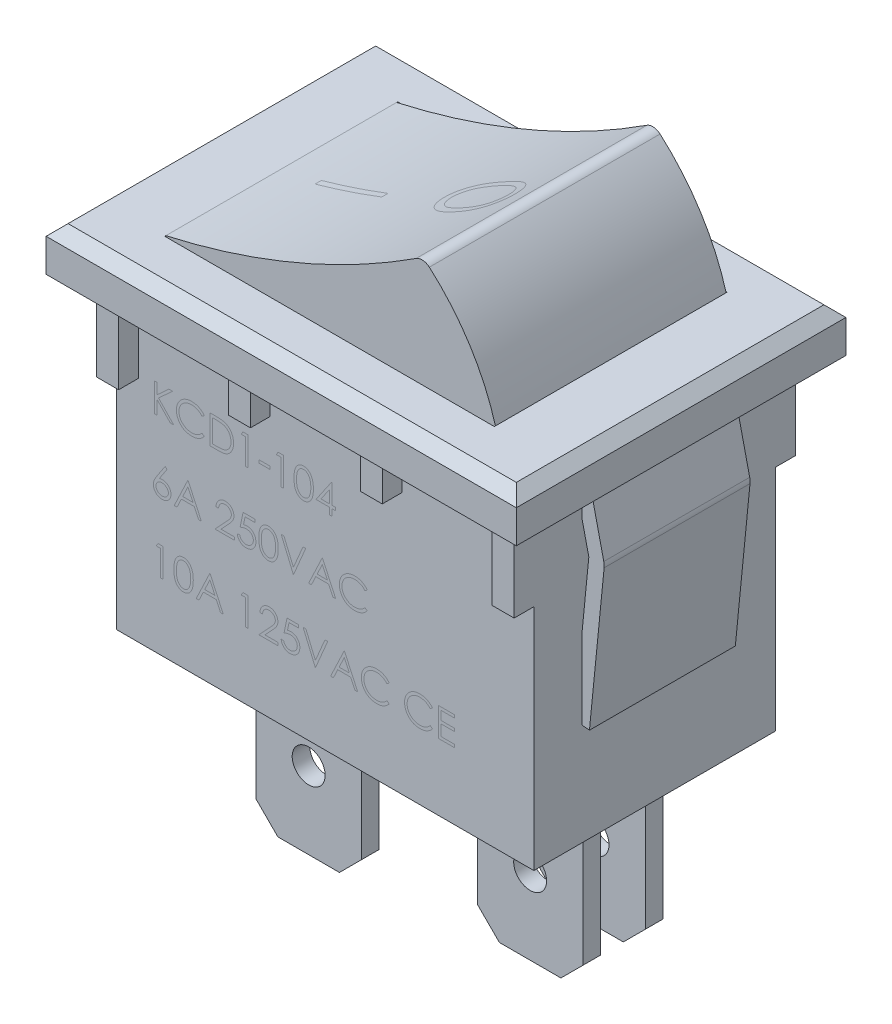
from build123d import *
from build123d.topology import SkipClean

# Parameters (mm, degrees)
SKETCH1_W              = 19
SKETCH1_H              = 14.4
BOSS_EXTRUDE1_DEPTH    = 5.5
SKETCH2_W              = 21.4
SKETCH2_H              = 15
BOSS_EXTRUDE2_DEPTH    = 2
CHAMFER1_SIZE          = 0.5
SKETCH11_W             = 15
SKETCH11_H             = 10.6
CUT_EXTRUDE6_DEPTH     = 0.25
BOSS_EXTRUDE3_DEPTH    = 5.25
SKETCH5_W              = 4.8
SKETCH5_H              = 0.8
BOSS_EXTRUDE5_DEPTH    = 7.3
CHAMFER2_SIZE          = 1
EXTRUDE_THIN14_DEPTH   = 3.32
EXTRUDE_THIN14_2_DEPTH = 3.32
SKETCH10_W             = 19
SKETCH10_H             = 14.4
CUT_EXTRUDE5_DEPTH     = 22.019333957
SKETCH12_R             = 0.75
CUT_EXTRUDE7_DEPTH     = 10
SKETCH13_W             = 1
SKETCH13_H             = 0.9
BOSS_EXTRUDE6_DEPTH    = 4
SKETCH14_W             = 1
SKETCH14_H             = 0.9
BOSS_EXTRUDE7_DEPTH    = 2.5
SKETCH15_R             = 0.5
CUT_EXTRUDE9_DEPTH     = 1.5
SKETCH17_R             = 0.75
CUT_EXTRUDE10_DEPTH    = 0.5
CUT_EXTRUDE11_DEPTH    = 0.4
CUT_EXTRUDE12_DEPTH    = 0.4


with BuildPart() as part:
    # Sketch1 → Boss-Extrude1 (new, symmetric)
    with BuildSketch(Plane.XY):
        Rectangle(SKETCH1_W, SKETCH1_H)
    extrude(amount=BOSS_EXTRUDE1_DEPTH, both=True)

    # Sketch2 → Boss-Extrude2 (add)
    with BuildSketch(Plane(origin=(0, 7.2, 0), x_dir=(1, 0, 0), z_dir=(0, 1, 0))):
        Rectangle(SKETCH2_W, SKETCH2_H)
    extrude(amount=BOSS_EXTRUDE2_DEPTH)

    # Chamfer1
    chamfer1_edges = [part.edges().sort_by_distance(p)[0] for p in [
        (0, 9.2, -7.5),
        (10.7, 9.2, 0),
        (0, 9.2, 7.5),
        (-10.7, 9.2, 0),
    ]]
    chamfer(chamfer1_edges, length=CHAMFER1_SIZE)

    # Sketch11 → Cut-Extrude6 (cut)
    with BuildSketch(Plane(origin=(0, 9.2, 0), x_dir=(1, 0, 0), z_dir=(0, 1, 0))):
        Rectangle(SKETCH11_W, SKETCH11_H)
    extrude(amount=-CUT_EXTRUDE6_DEPTH, mode=Mode.SUBTRACT)

    # Sketch3 → Boss-Extrude3 (add, symmetric)
    with BuildSketch(Plane.XY):
        with BuildLine():
            Line((-7.5, 9.2), (-7.5, 8.9))
            Line((-7.5, 8.9), (7.5, 8.9))
            Line((7.5, 8.9), (7.5, 9.2))
            ThreePointArc((7.5, 9.2), (6.337266906, 11.791954262), (4.492593026, 13.95236011))
            ThreePointArc((4.492593026, 13.95236011), (4.198663798, 14.075644793), (3.88996536, 13.996279949))
            ThreePointArc((3.88996536, 13.996279949), (-1.591643465, 11.091430432), (-7.5, 9.2))
        make_face()
    extrude(amount=BOSS_EXTRUDE3_DEPTH, both=True)

    # Sketch5 → Boss-Extrude5 (add)
    with BuildSketch(Plane.XZ.offset(7.2)):
        with Locations((5.65, 1.42)):
            Rectangle(SKETCH5_W, SKETCH5_H)
        with Locations((-3.55, -2.3)):
            Rectangle(SKETCH5_W, SKETCH5_H)
        with Locations((5.65, -1.42)):
            Rectangle(SKETCH5_W, SKETCH5_H)
        with Locations((-3.55, 2.3)):
            Rectangle(SKETCH5_W, SKETCH5_H)
    extrude(amount=BOSS_EXTRUDE5_DEPTH)

    # Chamfer2
    chamfer2_edges = [part.edges().sort_by_distance(p)[0] for p in [
        (8.05, -14.5, 1.42),
        (3.25, -14.5, 1.42),
        (-1.15, -14.5, -2.3),
        (-5.95, -14.5, -2.3),
        (8.05, -14.5, -1.42),
        (3.25, -14.5, -1.42),
        (-1.15, -14.5, 2.3),
        (-5.95, -14.5, 2.3),
    ]]
    chamfer(chamfer2_edges, length=CHAMFER2_SIZE)

    # Sketch12 → Cut-Extrude7 (cut)
    with BuildSketch(Plane.XY.offset(2.7)):
        with Locations((-3.55, -11)):
            Circle(SKETCH12_R)
        with Locations((5.65, -11)):
            Circle(SKETCH12_R)
    extrude(amount=-CUT_EXTRUDE7_DEPTH, mode=Mode.SUBTRACT)

    # Sketch13 → Boss-Extrude6 (add)
    with BuildSketch(Plane.XZ.offset(-7.2)):
        with Locations((-9, 5.95)):
            Rectangle(SKETCH13_W, SKETCH13_H)
        with Locations((9, 5.95)):
            Rectangle(SKETCH13_W, SKETCH13_H)
        with Locations((9, -5.95)):
            Rectangle(SKETCH13_W, SKETCH13_H)
        with Locations((-9, -5.95)):
            Rectangle(SKETCH13_W, SKETCH13_H)
    extrude(amount=BOSS_EXTRUDE6_DEPTH)

    # Sketch14 → Boss-Extrude7 (add)
    with BuildSketch(Plane.XZ.offset(-7.2)):
        with Locations((-3, 5.95)):
            Rectangle(SKETCH14_W, SKETCH14_H)
        with Locations((3, 5.95)):
            Rectangle(SKETCH14_W, SKETCH14_H)
        with Locations((3, -5.95)):
            Rectangle(SKETCH14_W, SKETCH14_H)
        with Locations((-3, -5.95)):
            Rectangle(SKETCH14_W, SKETCH14_H)
    extrude(amount=BOSS_EXTRUDE7_DEPTH)

    # Sketch15 → Cut-Extrude9 (cut)
    with BuildSketch(Plane.XY.offset(5.5)):
        with Locations((0, 6.2)):
            Circle(SKETCH15_R)
    extrude(amount=-CUT_EXTRUDE9_DEPTH, mode=Mode.SUBTRACT)

    # Sketch17 → Cut-Extrude10 (cut)
    with BuildSketch(Plane.XY.offset(5.5)):
        with Locations((0, 6.2)):
            Circle(SKETCH17_R)
    extrude(amount=-CUT_EXTRUDE10_DEPTH, mode=Mode.SUBTRACT)

    # Sketch18 → Revolve1 (revolve)
    with BuildSketch(Plane(origin=(0, 0, 0), x_dir=(0, 0, -1), z_dir=(1, 0, 0))):
        with BuildLine():
            Line((-5.5, 6.2), (-5, 6.2))
            Line((-5, 6.2), (-5, 6.95))
            ThreePointArc((-5, 6.95), (-5.354552722, 6.644701815), (-5.5, 6.2))
        make_face()
    revolve(axis=Axis((0, 6.2, 4), (0, 0, 1)))

    # Sketch19 → Cut-Extrude11 (cut)
    with BuildSketch(Plane.XY.offset(5.5)):
        with BuildLine():
            Line((-0.05, 6.948331477), (-0.05, 5.451668523))
            ThreePointArc((-0.05, 5.451668523), (0, 5.45), (0.05, 5.451668523))
            Line((0.05, 5.451668523), (0.05, 6.948331477))
            ThreePointArc((0.05, 6.948331477), (0, 6.95), (-0.05, 6.948331477))
        make_face()
    extrude(amount=-CUT_EXTRUDE11_DEPTH, mode=Mode.SUBTRACT)

    # Sketch20 → Cut-Extrude12 (cut)
    with SkipClean():  # the faces are left unmerged after this step: merging them gives an invalid solid
        with BuildSketch(Plane.XY.offset(5.5)):
            with BuildLine():
                Line((-0.748331477, 6.25), (0.748331477, 6.25))
                ThreePointArc((0.748331477, 6.25), (0.75, 6.2), (0.748331477, 6.15))
                Line((0.748331477, 6.15), (-0.748331477, 6.15))
                ThreePointArc((-0.748331477, 6.15), (-0.75, 6.2), (-0.748331477, 6.25))
            make_face()
        extrude(amount=-CUT_EXTRUDE12_DEPTH, mode=Mode.SUBTRACT)


with BuildPart() as body_2:
    # Sketch9 → Extrude-Thin14 (new, symmetric)
    with BuildSketch(Plane.XY):
        with BuildLine():
            Line((-9.841182523, 7.278067188), (-10.501606571, 4.391769498))
            ThreePointArc((-10.501606571, 4.391769498), (-10.519013265, 4.271701672), (-10.516833193, 4.150398238))
            Line((-10.516833193, 4.150398238), (-9.84828828, -2.584572734))
            Line((-9.84828828, -2.584572734), (-9.15171172, -2.515427266))
            Line((-9.15171172, -2.515427266), (-9.820256632, 4.219543705))
            ThreePointArc((-9.820256632, 4.219543705), (-9.820401971, 4.227630601), (-9.819241524, 4.235635123))
            Line((-9.819241524, 4.235635123), (-9.158817477, 7.121932812))
            Line((-9.158817477, 7.121932812), (-9.841182523, 7.278067188))
        make_face()
    extrude(amount=EXTRUDE_THIN14_DEPTH, both=True)


with BuildPart() as body_3:
    # Sketch9 → Extrude-Thin14 2 (new, symmetric)
    with BuildSketch(Plane.XY):
        with BuildLine():
            Line((9.158817477, 7.121932812), (9.819241524, 4.235635123))
            ThreePointArc((9.819241524, 4.235635123), (9.820401971, 4.227630601), (9.820256632, 4.219543705))
            Line((9.820256632, 4.219543705), (9.15171172, -2.515427266))
            Line((9.15171172, -2.515427266), (9.84828828, -2.584572734))
            Line((9.84828828, -2.584572734), (10.516833193, 4.150398238))
            ThreePointArc((10.516833193, 4.150398238), (10.519013265, 4.271701672), (10.501606571, 4.391769498))
            Line((10.501606571, 4.391769498), (9.841182523, 7.278067188))
            Line((9.841182523, 7.278067188), (9.158817477, 7.121932812))
        make_face()
    extrude(amount=EXTRUDE_THIN14_2_DEPTH, both=True)


with BuildPart() as cut_extrude5_tool:
    # Sketch10 → Cut-Extrude5 (new, through all)
    with BuildSketch(Plane.XY.offset(3.32)):
        Rectangle(SKETCH10_W, SKETCH10_H)
    extrude(amount=-CUT_EXTRUDE5_DEPTH)


with BuildPart() as body_2_1:
    add(body_2.part)

    # Cut-Extrude5: cut by cut_extrude5_tool
    add(cut_extrude5_tool.part, mode=Mode.SUBTRACT)


with BuildPart() as body_3_1:
    add(body_3.part)

    # Cut-Extrude5: cut by cut_extrude5_tool
    add(cut_extrude5_tool.part, mode=Mode.SUBTRACT)


solid = Compound([part.part, body_2_1.part, body_3_1.part])
